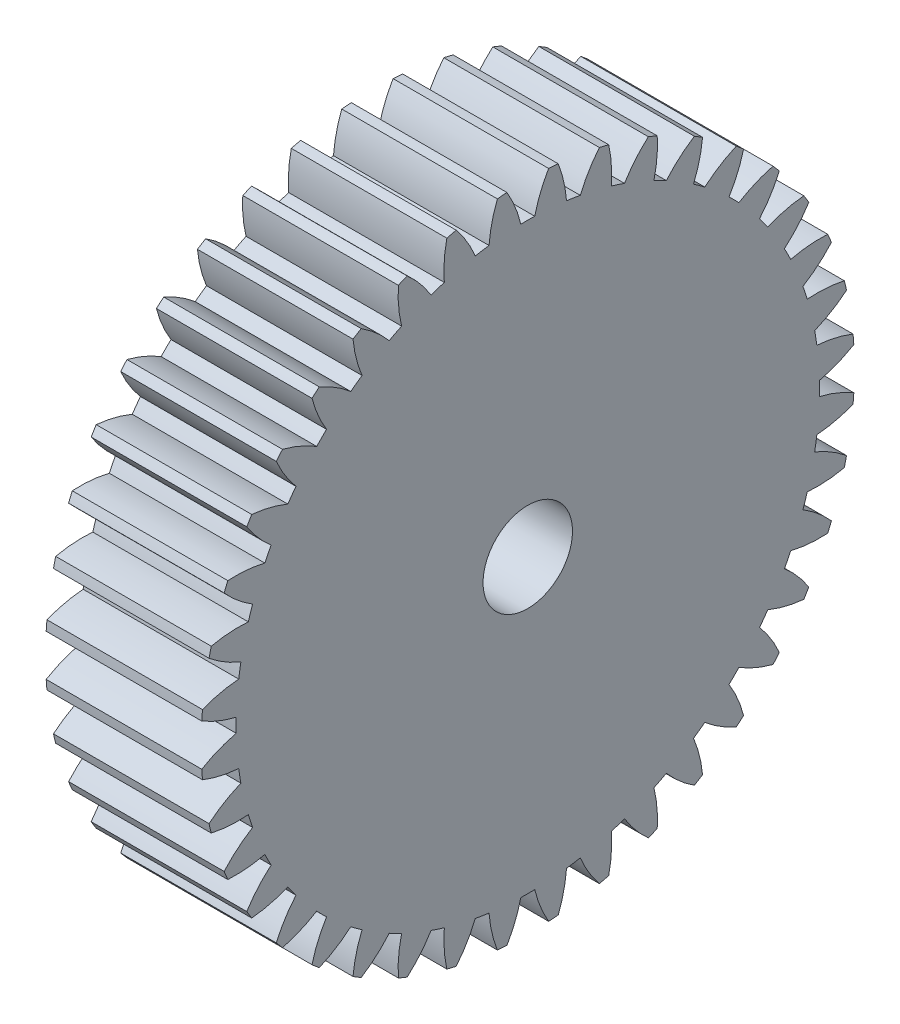
from build123d import *

# Parameters (mm, degrees)
SKETCH1_R           = 0.4
BOSS_EXTRUDE1_DEPTH = 4
SKETCH2_R           = 1.15
CUT_EXTRUDE1_DEPTH  = 23.809311719


with BuildPart() as part:
    # Sketch1 → Boss-Extrude1 (new body)
    with BuildSketch(Plane(origin=(-1.595003587, 0, 0), x_dir=(0, 0, -1), z_dir=(1, 0, 0))):
        with BuildLine():
            ThreePointArc((-16.421043875, 7.469942673), (-15.991410659, 7.258334451), (-15.535008147, 7.113215577))
            ThreePointArc((-15.535008147, 7.113215577), (-15.537144789, 6.93421615), (-15.535008147, 6.755216723))
            ThreePointArc((-15.535008147, 6.755216723), (-15.991410659, 6.610097848), (-16.421043875, 6.398489626))
            ThreePointArc((-16.421043875, 6.398489626), (-16.412250392, 6.275159746), (-16.401642569, 6.151972656))
            ThreePointArc((-16.401642569, 6.151972656), (-15.944196031, 6.010179126), (-15.470710998, 5.938243988))
            ThreePointArc((-15.470710998, 5.938243988), (-15.444819655, 5.761114096), (-15.414707639, 5.584652694))
            ThreePointArc((-15.414707639, 5.584652694), (-15.842789485, 5.369923391), (-16.234030385, 5.093710975))
            ThreePointArc((-16.234030385, 5.093710975), (-16.20605212, 4.973275093), (-16.176304191, 4.853264071))
            ThreePointArc((-16.176304191, 4.853264071), (-15.702308183, 4.784776658), (-15.223399402, 4.787796539))
            ThreePointArc((-15.223399402, 4.787796539), (-15.170117605, 4.616897709), (-15.112771672, 4.447319396))
            ThreePointArc((-15.112771672, 4.447319396), (-15.501992057, 4.168267012), (-15.845206991, 3.834251669))
            ThreePointArc((-15.845206991, 3.834251669), (-15.798732862, 3.719675318), (-15.750577319, 3.605795432))
            ThreePointArc((-15.750577319, 3.605795432), (-15.271703197, 3.612300524), (-14.799162991, 3.690201065))
            ThreePointArc((-14.799162991, 3.690201065), (-14.719802714, 3.529741392), (-14.636634912, 3.37122175))
            ThreePointArc((-14.636634912, 3.37122175), (-14.977409938, 3.034717482), (-15.264147815, 2.651123777))
            ThreePointArc((-15.264147815, 2.651123777), (-15.20032217, 2.545228206), (-15.134944762, 2.440283557))
            ThreePointArc((-15.134944762, 2.440283557), (-14.662983996, 2.521620978), (-14.208447873, 2.672484008))
            ThreePointArc((-14.208447873, 2.672484008), (-14.10496323, 2.526414543), (-13.998021427, 2.382856851))
            ThreePointArc((-13.998021427, 2.382856851), (-14.281960081, 1.99718655), (-14.505160462, 1.573459834))
            ThreePointArc((-14.505160462, 1.573459834), (-14.4255549, 1.478852544), (-14.344565436, 1.385427217))
            ThreePointArc((-14.344565436, 1.385427217), (-13.891139267, 1.53959417), (-13.465799416, 1.75970494))
            ThreePointArc((-13.465799416, 1.75970494), (-13.340738541, 1.631622397), (-13.212655998, 1.506561523))
            ThreePointArc((-13.212655998, 1.506561523), (-13.432766769, 1.081221672), (-13.586933722, 0.627795502))
            ThreePointArc((-13.586933722, 0.627795502), (-13.493508395, 0.546806039), (-13.398901105, 0.467200476))
            ThreePointArc((-13.398901105, 0.467200476), (-12.975174389, 0.690400858), (-12.589504088, 0.974339512))
            ThreePointArc((-12.589504088, 0.974339512), (-12.445946396, 0.867397709), (-12.299876931, 0.763913065))
            ThreePointArc((-12.299876931, 0.763913065), (-12.45073996, 0.309376943), (-12.532077382, -0.162583823))
            ThreePointArc((-12.532077382, -0.162583823), (-12.427132733, -0.227961231), (-12.321237162, -0.291786876))
            ThreePointArc((-12.321237162, -0.291786876), (-11.937643457, -0.005048999), (-11.601139189, 0.335726026))
            ThreePointArc((-11.601139189, 0.335726026), (-11.442619547, 0.252558225), (-11.282159874, 0.173197948))
            ThreePointArc((-11.282159874, 0.173197948), (-11.360060414, -0.299342258), (-11.366565507, -0.77821638))
            ThreePointArc((-11.366565507, -0.77821638), (-11.252685621, -0.826371923), (-11.13810927, -0.872846052))
            ThreePointArc((-11.13810927, -0.872846052), (-10.804093926, -0.529631118), (-10.525041542, -0.140410734))
            ThreePointArc((-10.525041542, -0.140410734), (-10.35546323, -0.197756666), (-10.1845644, -0.251038463))
            ThreePointArc((-10.1845644, -0.251038463), (-10.187584281, -0.729947245), (-10.119096868, -1.203943252))
            ThreePointArc((-10.119096868, -1.203943252), (-9.999085845, -1.233691182), (-9.878649964, -1.261669446))
            ThreePointArc((-9.878649964, -1.261669446), (-9.602437548, -0.870428546), (-9.387708245, -0.4423467))
            ThreePointArc((-9.387708245, -0.4423467), (-9.211246842, -0.472458717), (-9.034116951, -0.498350059))
            ThreePointArc((-9.034116951, -0.498350059), (-8.962181813, -0.971835092), (-8.820388282, -1.42928163))
            ThreePointArc((-8.820388282, -1.42928163), (-8.697201193, -1.439889454), (-8.573871312, -1.448682937))
            ThreePointArc((-8.573871312, -1.448682937), (-8.362263091, -1.01904972), (-8.217144216, -0.562647208))
            ThreePointArc((-8.217144216, -0.562647208), (-8.038144789, -0.56478385), (-7.859145362, -0.562647208))
            ThreePointArc((-7.859145362, -0.562647208), (-7.714026487, -1.01904972), (-7.502418266, -1.448682937))
            ThreePointArc((-7.502418266, -1.448682937), (-7.379088385, -1.439889454), (-7.255901296, -1.42928163))
            ThreePointArc((-7.255901296, -1.42928163), (-7.114107765, -0.971835092), (-7.042172627, -0.498350059))
            ThreePointArc((-7.042172627, -0.498350059), (-6.865042736, -0.472458717), (-6.688581333, -0.4423467))
            ThreePointArc((-6.688581333, -0.4423467), (-6.47385203, -0.870428546), (-6.197639614, -1.261669446))
            ThreePointArc((-6.197639614, -1.261669446), (-6.077203733, -1.233691182), (-5.95719271, -1.203943252))
            ThreePointArc((-5.95719271, -1.203943252), (-5.888705297, -0.729947245), (-5.891725178, -0.251038463))
            ThreePointArc((-5.891725178, -0.251038463), (-5.720826348, -0.197756666), (-5.551248036, -0.140410734))
            ThreePointArc((-5.551248036, -0.140410734), (-5.272195652, -0.529631118), (-4.938180308, -0.872846052))
            ThreePointArc((-4.938180308, -0.872846052), (-4.823603957, -0.826371923), (-4.709724071, -0.77821638))
            ThreePointArc((-4.709724071, -0.77821638), (-4.716229164, -0.299342258), (-4.794129704, 0.173197948))
            ThreePointArc((-4.794129704, 0.173197948), (-4.633670031, 0.252558225), (-4.47515039, 0.335726026))
            ThreePointArc((-4.47515039, 0.335726026), (-4.138646121, -0.005048999), (-3.755052416, -0.291786876))
            ThreePointArc((-3.755052416, -0.291786876), (-3.649156845, -0.227961231), (-3.544212196, -0.162583823))
            ThreePointArc((-3.544212196, -0.162583823), (-3.625549618, 0.309376943), (-3.776412647, 0.763913065))
            ThreePointArc((-3.776412647, 0.763913065), (-3.630343182, 0.867397709), (-3.486785491, 0.974339512))
            ThreePointArc((-3.486785491, 0.974339512), (-3.101115189, 0.690400858), (-2.677388473, 0.467200476))
            ThreePointArc((-2.677388473, 0.467200476), (-2.582781183, 0.546806039), (-2.489355857, 0.627795502))
            ThreePointArc((-2.489355857, 0.627795502), (-2.643522809, 1.081221672), (-2.86363358, 1.506561523))
            ThreePointArc((-2.86363358, 1.506561523), (-2.735551037, 1.631622397), (-2.610490163, 1.75970494))
            ThreePointArc((-2.610490163, 1.75970494), (-2.185150311, 1.53959417), (-1.731724142, 1.385427217))
            ThreePointArc((-1.731724142, 1.385427217), (-1.650734678, 1.478852544), (-1.571129116, 1.573459834))
            ThreePointArc((-1.571129116, 1.573459834), (-1.794329498, 1.99718655), (-2.078268151, 2.382856851))
            ThreePointArc((-2.078268151, 2.382856851), (-1.971326348, 2.526414543), (-1.867841705, 2.672484008))
            ThreePointArc((-1.867841705, 2.672484008), (-1.413305582, 2.521620978), (-0.941344816, 2.440283557))
            ThreePointArc((-0.941344816, 2.440283557), (-0.875967408, 2.545228206), (-0.812141763, 2.651123777))
            ThreePointArc((-0.812141763, 2.651123777), (-1.09887964, 3.034717482), (-1.439654666, 3.37122175))
            ThreePointArc((-1.439654666, 3.37122175), (-1.356486864, 3.529741392), (-1.277126587, 3.690201065))
            ThreePointArc((-1.277126587, 3.690201065), (-0.804586381, 3.612300524), (-0.325712259, 3.605795432))
            ThreePointArc((-0.325712259, 3.605795432), (-0.277556716, 3.719675318), (-0.231082588, 3.834251669))
            ThreePointArc((-0.231082588, 3.834251669), (-0.574297521, 4.168267012), (-0.963517906, 4.447319396))
            ThreePointArc((-0.963517906, 4.447319396), (-0.906171973, 4.616897709), (-0.852890176, 4.787796539))
            ThreePointArc((-0.852890176, 4.787796539), (-0.373981395, 4.784776658), (0.100014613, 4.853264071))
            ThreePointArc((0.100014613, 4.853264071), (0.129762542, 4.973275093), (0.157740807, 5.093710975))
            ThreePointArc((0.157740807, 5.093710975), (-0.233500093, 5.369923391), (-0.661581939, 5.584652694))
            ThreePointArc((-0.661581939, 5.584652694), (-0.631469923, 5.761114096), (-0.60557858, 5.938243988))
            ThreePointArc((-0.60557858, 5.938243988), (-0.132093547, 6.010179126), (0.325352991, 6.151972656))
            ThreePointArc((0.325352991, 6.151972656), (0.335960814, 6.275159746), (0.344754297, 6.398489626))
            ThreePointArc((0.344754297, 6.398489626), (-0.08487892, 6.610097848), (-0.541281431, 6.755216723))
            ThreePointArc((-0.541281431, 6.755216723), (-0.539144789, 6.93421615), (-0.541281431, 7.113215577))
            ThreePointArc((-0.541281431, 7.113215577), (-0.08487892, 7.258334451), (0.344754297, 7.469942673))
            ThreePointArc((0.344754297, 7.469942673), (0.335960814, 7.593272554), (0.325352991, 7.716459643))
            ThreePointArc((0.325352991, 7.716459643), (-0.132093547, 7.858253174), (-0.60557858, 7.930188312))
            ThreePointArc((-0.60557858, 7.930188312), (-0.631469923, 8.107318203), (-0.661581939, 8.283779605))
            ThreePointArc((-0.661581939, 8.283779605), (-0.233500093, 8.498508909), (0.157740807, 8.774721324))
            ThreePointArc((0.157740807, 8.774721324), (0.129762542, 8.895157206), (0.100014613, 9.015168229))
            ThreePointArc((0.100014613, 9.015168229), (-0.373981395, 9.083655641), (-0.852890176, 9.08063576))
            ThreePointArc((-0.852890176, 9.08063576), (-0.906171973, 9.25153459), (-0.963517906, 9.421112903))
            ThreePointArc((-0.963517906, 9.421112903), (-0.574297521, 9.700165287), (-0.231082588, 10.03418063))
            ThreePointArc((-0.231082588, 10.03418063), (-0.277556716, 10.148756981), (-0.325712259, 10.262636868))
            ThreePointArc((-0.325712259, 10.262636868), (-0.804586381, 10.256131775), (-1.277126587, 10.178231235))
            ThreePointArc((-1.277126587, 10.178231235), (-1.356486864, 10.338690907), (-1.439654666, 10.497210549))
            ThreePointArc((-1.439654666, 10.497210549), (-1.09887964, 10.833714818), (-0.812141763, 11.217308522))
            ThreePointArc((-0.812141763, 11.217308522), (-0.875967408, 11.323204093), (-0.941344816, 11.428148742))
            ThreePointArc((-0.941344816, 11.428148742), (-1.413305582, 11.346811321), (-1.867841705, 11.195948291))
            ThreePointArc((-1.867841705, 11.195948291), (-1.971326348, 11.342017757), (-2.078268151, 11.485575448))
            ThreePointArc((-2.078268151, 11.485575448), (-1.794329498, 11.871245749), (-1.571129116, 12.294972466))
            ThreePointArc((-1.571129116, 12.294972466), (-1.650734678, 12.389579756), (-1.731724142, 12.483005082))
            ThreePointArc((-1.731724142, 12.483005082), (-2.185150311, 12.32883813), (-2.610490163, 12.108727359))
            ThreePointArc((-2.610490163, 12.108727359), (-2.735551037, 12.236809902), (-2.86363358, 12.361870776))
            ThreePointArc((-2.86363358, 12.361870776), (-2.643522809, 12.787210628), (-2.489355857, 13.240636797))
            ThreePointArc((-2.489355857, 13.240636797), (-2.582781183, 13.321626261), (-2.677388473, 13.401231823))
            ThreePointArc((-2.677388473, 13.401231823), (-3.101115189, 13.178031441), (-3.486785491, 12.894092787))
            ThreePointArc((-3.486785491, 12.894092787), (-3.630343182, 13.00103459), (-3.776412647, 13.104519234))
            ThreePointArc((-3.776412647, 13.104519234), (-3.625549618, 13.559055357), (-3.544212196, 14.031016122))
            ThreePointArc((-3.544212196, 14.031016122), (-3.649156845, 14.09639353), (-3.755052416, 14.160219175))
            ThreePointArc((-3.755052416, 14.160219175), (-4.138646121, 13.873481298), (-4.47515039, 13.532706273))
            ThreePointArc((-4.47515039, 13.532706273), (-4.633670031, 13.615874075), (-4.794129704, 13.695234352))
            ThreePointArc((-4.794129704, 13.695234352), (-4.716229164, 14.167774558), (-4.709724071, 14.646648679))
            ThreePointArc((-4.709724071, 14.646648679), (-4.823603957, 14.694804223), (-4.938180308, 14.741278351))
            ThreePointArc((-4.938180308, 14.741278351), (-5.272195652, 14.398063417), (-5.551248036, 14.008843033))
            ThreePointArc((-5.551248036, 14.008843033), (-5.720826348, 14.066188965), (-5.891725178, 14.119470763))
            ThreePointArc((-5.891725178, 14.119470763), (-5.888705297, 14.598379544), (-5.95719271, 15.072375551))
            ThreePointArc((-5.95719271, 15.072375551), (-6.077203733, 15.102123481), (-6.197639614, 15.130101746))
            ThreePointArc((-6.197639614, 15.130101746), (-6.47385203, 14.738860845), (-6.688581333, 14.310779))
            ThreePointArc((-6.688581333, 14.310779), (-6.865042736, 14.340891016), (-7.042172627, 14.366782359))
            ThreePointArc((-7.042172627, 14.366782359), (-7.114107765, 14.840267392), (-7.255901296, 15.29771393))
            ThreePointArc((-7.255901296, 15.29771393), (-7.379088385, 15.308321753), (-7.502418266, 15.317115236))
            ThreePointArc((-7.502418266, 15.317115236), (-7.714026487, 14.887482019), (-7.859145362, 14.431079507))
            ThreePointArc((-7.859145362, 14.431079507), (-8.038144789, 14.43321615), (-8.217144216, 14.431079507))
            ThreePointArc((-8.217144216, 14.431079507), (-8.362263091, 14.887482019), (-8.573871312, 15.317115236))
            ThreePointArc((-8.573871312, 15.317115236), (-8.697201193, 15.308321753), (-8.820388282, 15.29771393))
            ThreePointArc((-8.820388282, 15.29771393), (-8.962181813, 14.840267392), (-9.034116951, 14.366782359))
            ThreePointArc((-9.034116951, 14.366782359), (-9.211246842, 14.340891016), (-9.387708245, 14.310779))
            ThreePointArc((-9.387708245, 14.310779), (-9.602437548, 14.738860845), (-9.878649964, 15.130101746))
            ThreePointArc((-9.878649964, 15.130101746), (-9.999085845, 15.102123481), (-10.119096868, 15.072375551))
            ThreePointArc((-10.119096868, 15.072375551), (-10.187584281, 14.598379544), (-10.1845644, 14.119470763))
            ThreePointArc((-10.1845644, 14.119470763), (-10.35546323, 14.066188965), (-10.525041542, 14.008843033))
            ThreePointArc((-10.525041542, 14.008843033), (-10.804093926, 14.398063417), (-11.13810927, 14.741278351))
            ThreePointArc((-11.13810927, 14.741278351), (-11.252685621, 14.694804223), (-11.366565507, 14.646648679))
            ThreePointArc((-11.366565507, 14.646648679), (-11.360060414, 14.167774558), (-11.282159874, 13.695234352))
            ThreePointArc((-11.282159874, 13.695234352), (-11.442619547, 13.615874075), (-11.601139189, 13.532706273))
            ThreePointArc((-11.601139189, 13.532706273), (-11.937643457, 13.873481298), (-12.321237162, 14.160219175))
            ThreePointArc((-12.321237162, 14.160219175), (-12.427132733, 14.09639353), (-12.532077382, 14.031016122))
            ThreePointArc((-12.532077382, 14.031016122), (-12.45073996, 13.559055357), (-12.299876931, 13.104519234))
            ThreePointArc((-12.299876931, 13.104519234), (-12.445946396, 13.00103459), (-12.589504088, 12.894092787))
            ThreePointArc((-12.589504088, 12.894092787), (-12.975174389, 13.178031441), (-13.398901105, 13.401231823))
            ThreePointArc((-13.398901105, 13.401231823), (-13.493508395, 13.321626261), (-13.586933722, 13.240636797))
            ThreePointArc((-13.586933722, 13.240636797), (-13.432766769, 12.787210628), (-13.212655998, 12.361870776))
            ThreePointArc((-13.212655998, 12.361870776), (-13.340738541, 12.236809902), (-13.465799416, 12.108727359))
            ThreePointArc((-13.465799416, 12.108727359), (-13.891139267, 12.32883813), (-14.344565436, 12.483005082))
            ThreePointArc((-14.344565436, 12.483005082), (-14.4255549, 12.389579756), (-14.505160462, 12.294972466))
            ThreePointArc((-14.505160462, 12.294972466), (-14.281960081, 11.871245749), (-13.998021427, 11.485575448))
            ThreePointArc((-13.998021427, 11.485575448), (-14.10496323, 11.342017757), (-14.208447873, 11.195948291))
            ThreePointArc((-14.208447873, 11.195948291), (-14.662983996, 11.346811321), (-15.134944762, 11.428148742))
            ThreePointArc((-15.134944762, 11.428148742), (-15.20032217, 11.323204093), (-15.264147815, 11.217308522))
            ThreePointArc((-15.264147815, 11.217308522), (-14.977409938, 10.833714818), (-14.636634912, 10.497210549))
            ThreePointArc((-14.636634912, 10.497210549), (-14.719802714, 10.338690907), (-14.799162991, 10.178231235))
            ThreePointArc((-14.799162991, 10.178231235), (-15.271703197, 10.256131775), (-15.750577319, 10.262636868))
            ThreePointArc((-15.750577319, 10.262636868), (-15.798732862, 10.148756981), (-15.845206991, 10.03418063))
            ThreePointArc((-15.845206991, 10.03418063), (-15.501992057, 9.700165287), (-15.112771672, 9.421112903))
            ThreePointArc((-15.112771672, 9.421112903), (-15.170117605, 9.25153459), (-15.223399402, 9.08063576))
            ThreePointArc((-15.223399402, 9.08063576), (-15.702308183, 9.083655641), (-16.176304191, 9.015168229))
            ThreePointArc((-16.176304191, 9.015168229), (-16.20605212, 8.895157206), (-16.234030385, 8.774721324))
            ThreePointArc((-16.234030385, 8.774721324), (-15.842789485, 8.498508909), (-15.414707639, 8.283779605))
            ThreePointArc((-15.414707639, 8.283779605), (-15.444819655, 8.107318203), (-15.470710998, 7.930188312))
            ThreePointArc((-15.470710998, 7.930188312), (-15.944196031, 7.858253174), (-16.401642569, 7.716459643))
            ThreePointArc((-16.401642569, 7.716459643), (-16.412250392, 7.593272554), (-16.421043875, 7.469942673))
        make_face()
        with Locations((-8.038144789, 6.93421615)):
            Circle(SKETCH1_R, mode=Mode.SUBTRACT)
    extrude(amount=-BOSS_EXTRUDE1_DEPTH)

    # Sketch2 → Cut-Extrude1 (cut, through all)
    with BuildSketch(Plane(origin=(-1.595003587, 0, 0), x_dir=(0, 0, -1), z_dir=(1, 0, 0))):
        with Locations((-8.038144789, 6.93421615)):
            Circle(SKETCH2_R)
    extrude(amount=-CUT_EXTRUDE1_DEPTH, mode=Mode.SUBTRACT)


solid = part.part
